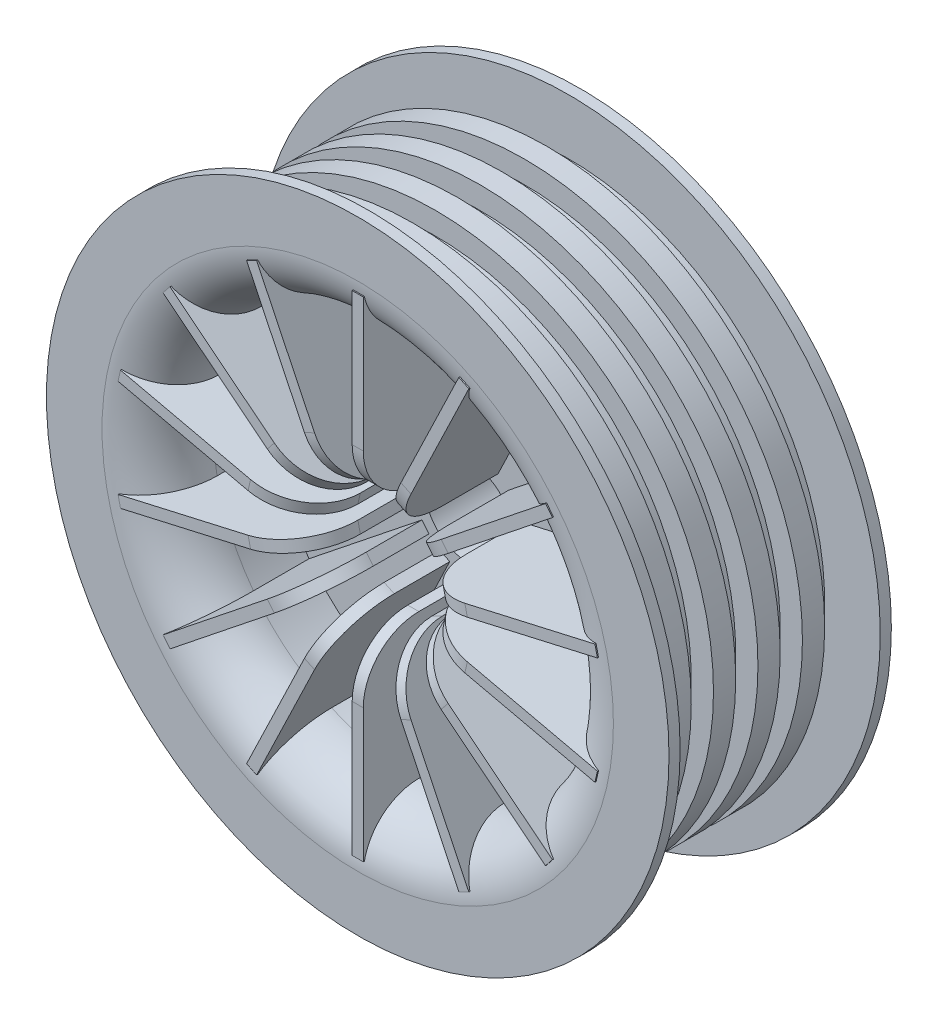
from build123d import *

# Parameters (mm, degrees)
SKETCH1_R                = 28
BOSS_EXTRUDE1_DEPTH      = 20
SHELL1_T                 = -10
SKETCH2_R                = 4
CUT_EXTRUDE1_DEPTH       = 20
SKETCH3_W                = 3
SKETCH3_H                = 18
SKETCH4_W                = 2
SKETCH4_H                = 2
LPATTERN1_COUNT          = 5
LPATTERN1_PITCH          = 4
SKETCH5_R                = 18
SKETCH5_R_2              = 7.5
CUT_EXTRUDE2_DEPTH       = 5
FILLET1_R                = 5
EXTRUDE_THIN1_REACH      = 46.362
SKETCH6_W                = 1
SKETCH6_H                = 17
FILLET2_R                = 5
CIRPATTERN1_COUNT        = 14
FILLET2_OF_CIRPATTERN1_R = 5
SKETCH7_W                = 2
SKETCH7_H                = 2
CUT_EXTRUDE3_DEPTH       = 19


with BuildPart() as part:
    # Sketch1 → Boss-Extrude1 (new body)
    with BuildSketch(Plane.XY):
        Circle(SKETCH1_R)
    extrude(amount=BOSS_EXTRUDE1_DEPTH)

    # Shell1
    shell1_openings = [part.faces().sort_by_distance(p)[0] for p in [
        (0, 0, 20),
    ]]
    offset(amount=SHELL1_T, openings=shell1_openings, kind=Kind.INTERSECTION)

    # Sketch2 → Cut-Extrude1 (cut)
    with BuildSketch(Plane.XY.offset(10)):
        Circle(SKETCH2_R)
    extrude(amount=-CUT_EXTRUDE1_DEPTH, mode=Mode.SUBTRACT)

    # Sketch3 → Cut-Revolve1 (revolve, cut)
    with BuildSketch(Plane(origin=(0, 0, 0), x_dir=(1, 0, 0), z_dir=(0, 1, 0))):
        with Locations((26.5, -10)):
            Rectangle(SKETCH3_W, SKETCH3_H)
    revolve(axis=Axis((0, 0, 20), (0, 0, -1)), mode=Mode.SUBTRACT)

    # Sketch4 → Cut-Revolve2 (revolve, cut)
    with BuildSketch(Plane(origin=(0, 0, 0), x_dir=(1, 0, 0), z_dir=(0, 1, 0))):
        with Locations((24, -2)):
            Rectangle(SKETCH4_W, SKETCH4_H)
    cut_revolve2 = revolve(axis=Axis((0, 0, -10), (0, 0, 1)), mode=Mode.SUBTRACT)

    # LPattern1: Cut-Revolve2 ×5
    with Locations(*[(0, 0, i * LPATTERN1_PITCH) for i in range(1, LPATTERN1_COUNT)]):
        add(cut_revolve2, mode=Mode.SUBTRACT)

    # Sketch5 → Cut-Extrude2 (cut)
    with BuildSketch(Plane(origin=(0, 0, 0), x_dir=(-1, 0, 0), z_dir=(0, 0, -1))):
        with Locations(Location((0, 0, 0), (0, 0, 180))):
            Circle(SKETCH5_R)
        Circle(SKETCH5_R_2, mode=Mode.SUBTRACT)
    extrude(amount=-CUT_EXTRUDE2_DEPTH, mode=Mode.SUBTRACT)

    # Fillet1
    fillet1_edges = [part.edges().sort_by_distance(p)[0] for p in [
        (-18, 0, 0),
        (-18, 0, 20),
    ]]
    fillet(fillet1_edges, radius=FILLET1_R - 0.0001)  # a hair under: the kernel refuses the full size

    # Extrude-Thin1: up to this face of the body (flat: up to its plane)
    extrude_thin1_end = Plane(part.part.faces().sort_by_distance((-17.490883118, 0, 10))[0])
    # Sketch6 → Extrude-Thin1 (add, up to the picked face)
    with BuildSketch(Plane.XY.offset(20), mode=Mode.PRIVATE) as extrude_thin1_sk1:
        with Locations((0, 13.5)):
            Rectangle(SKETCH6_W, SKETCH6_H)
    extrude_thin1_tool1 = split(extrude(extrude_thin1_sk1.sketch, amount=-EXTRUDE_THIN1_REACH, mode=Mode.PRIVATE), bisect_by=extrude_thin1_end, keep=Keep.BOTH, mode=Mode.PRIVATE)
    extrude_thin1 = extrude_thin1_tool1.solids().sort_by(Axis((0, 13.5, 20), (0, 0, -1)))[0]
    add(extrude_thin1)

    # Fillet2
    fillet2_edges = [part.edges().sort_by_distance(p)[0] for p in [
        (0, 5, 20),
    ]]
    fillet(fillet2_edges, radius=FILLET2_R)

    # CirPattern1: Extrude-Thin1 ×14 about axis
    cirpattern1_axis = Axis((0, 0, 0), (0, 0, 1))
    for i in range(1, CIRPATTERN1_COUNT):
        add(extrude_thin1.rotate(cirpattern1_axis, i * 360 / CIRPATTERN1_COUNT))

    # Fillet2 of CirPattern1
    fillet2_of_cirpattern1_edges = [part.edges().sort_by_distance(p)[0] for p in [
        (-2.169418696, 4.50484434, 20),
        (-3.909157412, 3.117449009, 20),
        (-4.874639561, 1.11260467, 20),
        (-4.874639561, -1.11260467, 20),
        (-3.909157412, -3.117449009, 20),
        (-2.169418696, -4.50484434, 20),
        (0, -5, 20),
        (2.169418696, -4.50484434, 20),
        (3.909157412, -3.117449009, 20),
        (4.874639561, -1.11260467, 20),
        (4.874639561, 1.11260467, 20),
        (3.909157412, 3.117449009, 20),
        (2.169418696, 4.50484434, 20),
    ]]
    fillet(fillet2_of_cirpattern1_edges, radius=FILLET2_OF_CIRPATTERN1_R)

    # Sketch7 → Cut-Extrude3 (cut)
    with BuildSketch(Plane.XY):
        with Locations((0, 4)):
            Rectangle(SKETCH7_W, SKETCH7_H)
    extrude(amount=CUT_EXTRUDE3_DEPTH, mode=Mode.SUBTRACT)


solid = part.part
